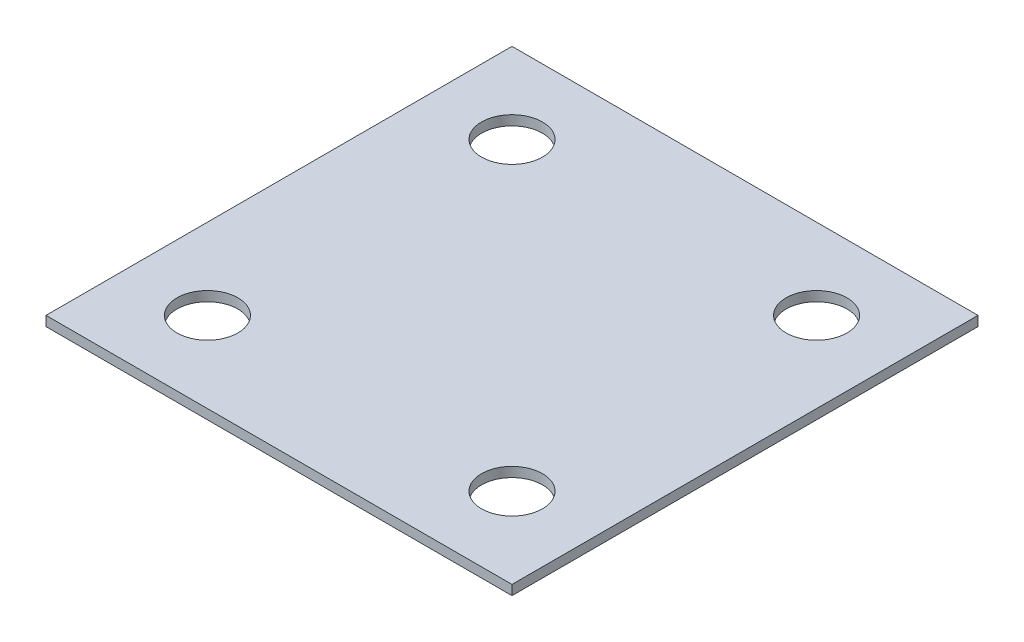
from build123d import *

# Parameters (mm, degrees)
SKETCH1_W           = 765
SKETCH1_H           = 765
BOSS_EXTRUDE1_DEPTH = 16
CUT_EXTRUDE2_REACH  = 543.173
SKETCH5_R           = 50


with BuildPart() as part:
    # Sketch1 → Boss-Extrude1 (new body)
    with BuildSketch(Plane(origin=(0, 0, 0), x_dir=(1, 0, 0), z_dir=(0, 1, 0))):
        Rectangle(SKETCH1_W, SKETCH1_H)
    extrude(amount=BOSS_EXTRUDE1_DEPTH)

    # Sketch5 → Cut-Extrude2 (cut, up to next)
    with BuildSketch(Plane(origin=(0, 16, 0), x_dir=(1, 0, 0), z_dir=(0, 1, 0)), mode=Mode.PRIVATE) as cut_extrude2_sk1:
        with Locations((-250, 250)):
            Circle(SKETCH5_R)
    cut_extrude2_tool1 = extrude(cut_extrude2_sk1.sketch, amount=-CUT_EXTRUDE2_REACH, mode=Mode.PRIVATE) & part.part
    # Sketch5 → Cut-Extrude2 (cut, up to next)
    with BuildSketch(Plane(origin=(0, 16, 0), x_dir=(1, 0, 0), z_dir=(0, 1, 0)), mode=Mode.PRIVATE) as cut_extrude2_sk2:
        with Locations((250, 250)):
            Circle(SKETCH5_R)
    cut_extrude2_tool2 = extrude(cut_extrude2_sk2.sketch, amount=-CUT_EXTRUDE2_REACH, mode=Mode.PRIVATE) & part.part
    # Sketch5 → Cut-Extrude2 (cut, up to next)
    with BuildSketch(Plane(origin=(0, 16, 0), x_dir=(1, 0, 0), z_dir=(0, 1, 0)), mode=Mode.PRIVATE) as cut_extrude2_sk3:
        with Locations((250, -250)):
            Circle(SKETCH5_R)
    cut_extrude2_tool3 = extrude(cut_extrude2_sk3.sketch, amount=-CUT_EXTRUDE2_REACH, mode=Mode.PRIVATE) & part.part
    # Sketch5 → Cut-Extrude2 (cut, up to next)
    with BuildSketch(Plane(origin=(0, 16, 0), x_dir=(1, 0, 0), z_dir=(0, 1, 0)), mode=Mode.PRIVATE) as cut_extrude2_sk4:
        with Locations((-250, -250)):
            Circle(SKETCH5_R)
    cut_extrude2_tool4 = extrude(cut_extrude2_sk4.sketch, amount=-CUT_EXTRUDE2_REACH, mode=Mode.PRIVATE) & part.part
    add(cut_extrude2_tool1.solids().sort_by_distance((-250, 16, -250))[0], mode=Mode.SUBTRACT)
    add(cut_extrude2_tool2.solids().sort_by_distance((250, 16, -250))[0], mode=Mode.SUBTRACT)
    add(cut_extrude2_tool3.solids().sort_by_distance((250, 16, 250))[0], mode=Mode.SUBTRACT)
    add(cut_extrude2_tool4.solids().sort_by_distance((-250, 16, 250))[0], mode=Mode.SUBTRACT)


solid = part.part
